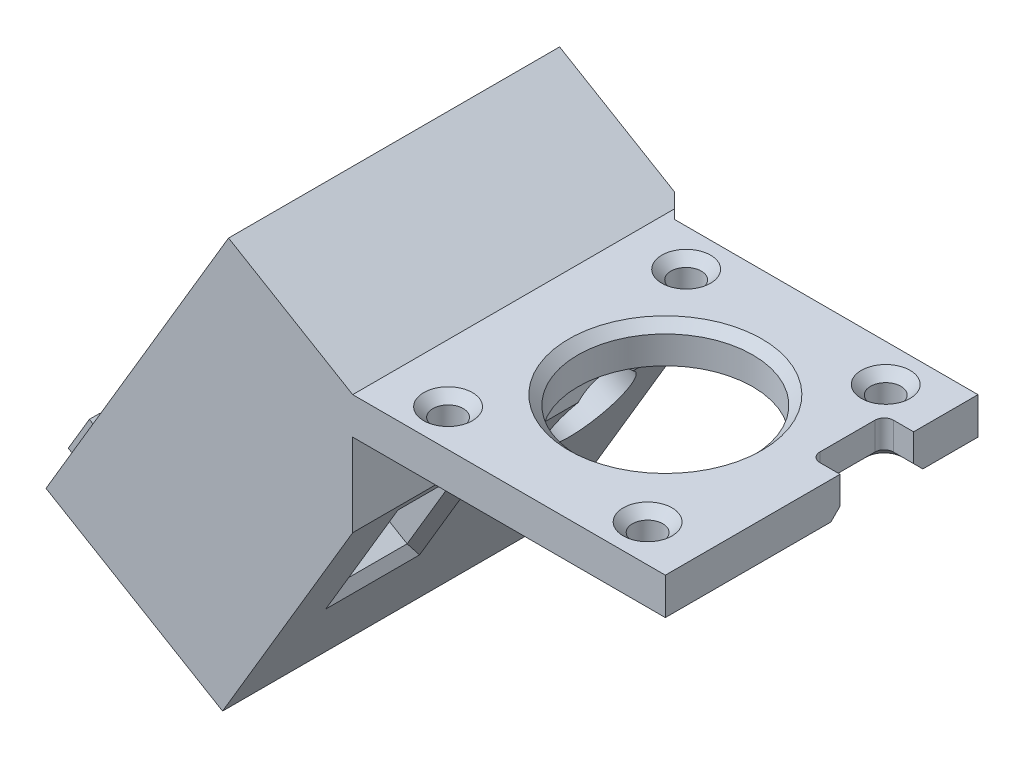
from build123d import *

# Parameters (mm, degrees)
BOSS_EXTRUDE1_DEPTH = 13
BOSS_EXTRUDE2_DEPTH = 2
BOSS_EXTRUDE3_DEPTH = 21
SKETCH4_R           = 4.5
CUT_EXTRUDE1_DEPTH  = 21
SKETCH6_W           = 8.2
SKETCH6_H           = 13.4
CUT_EXTRUDE2_DEPTH  = 21
SKETCH7_R           = 3
CUT_EXTRUDE3_DEPTH  = 21
CHAMFER1_SIZE       = 1
SKETCH8_W           = 1.64117647
SKETCH8_H           = 4.5
BOSS_EXTRUDE4_DEPTH = 1
SKETCH9_W           = 1.164705882
SKETCH9_H           = 4.5
BOSS_EXTRUDE5_DEPTH = 1
SKETCH11_R          = 9.5
SKETCH11_R_2        = 1.65
CUT_EXTRUDE4_DEPTH  = 11
CHAMFER2_SIZE       = 1
SKETCH12_R          = 1.25
CUT_EXTRUDE5_DEPTH  = 11
CHAMFER3_SIZE       = 1


with BuildPart() as part:
    # Sketch1 → Boss-Extrude1 (new body)
    with BuildSketch(Plane.XY):
        Polygon((-31.151261426, -32.880253656), (-50.352784268, -21.501573453), (-48.943272005, -19.123021508), (-46.792543171, -20.397527484), (-44.141570741, -15.924011509), (-40.01217138, -18.371062982), (-35.882772018, -11.40270156), (-32.269547577, -13.543871599), (-29.88430655, -9.518777366), (-25.030353635, -1.327731822), (-32.772977437, 3.260489691), (-30.122005008, 7.734005666), (-32.272733842, 9.008511642), (-30.5, 12), (-17, 4), (17, 4), (17, 0), (0, 0), (-17, 0), (-17, -9), (-22.352925098, -18.033061103), align=None)
    extrude(amount=BOSS_EXTRUDE1_DEPTH)

    # Sketch2 → Boss-Extrude2 (add)
    with BuildSketch(Plane(origin=(0, 0, 0), x_dir=(-1, 0, 0), z_dir=(0, 0, -1))):
        Polygon((30.5, 12), (50.352784268, -21.501573453), (31.151261426, -32.880253656), (17, -9), (17, 0), (17, 4), align=None)
    extrude(amount=BOSS_EXTRUDE2_DEPTH)

    # Sketch3 → Boss-Extrude3 (add)
    with BuildSketch(Plane.XY.offset(13)):
        Polygon((-30.5, 12), (-17, 4), (17, 4), (17, 0), (-17, 0), (-17, -9), (-31.151261426, -32.880253656), (-50.352784268, -21.501573453), align=None)
    extrude(amount=BOSS_EXTRUDE3_DEPTH)

    # Sketch4 → Cut-Extrude1 (cut)
    with BuildSketch(Plane(origin=(-17.942687972, 10.632703984, 0), x_dir=(0, 0, 1), z_dir=(-0.8602915336341741, 0.5098023903017335, 0))):
        with Locations(Location((6.5, -19.777770558, 0), (0, 0, 270))):
            Circle(SKETCH4_R)
    extrude(amount=-CUT_EXTRUDE1_DEPTH, mode=Mode.SUBTRACT)

    # Sketch6 → Cut-Extrude2 (cut)
    with BuildSketch(Plane(origin=(-23.534582941, 13.946419521, 0), x_dir=(0, 0, 1), z_dir=(-0.8602915336341743, 0.5098023903017327, 0))):
        with Locations((23.5, -25.052770558)):
            Rectangle(SKETCH6_W, SKETCH6_H)
    extrude(amount=-CUT_EXTRUDE2_DEPTH, mode=Mode.SUBTRACT)

    # Sketch7 → Cut-Extrude3 (cut)
    with BuildSketch(Plane(origin=(-23.534582941, 13.946419521, 0), x_dir=(0, 0, -1), z_dir=(0.8602915336341744, -0.5098023903017329, 0))):
        with Locations(Location((-23.5, -25.052770558, 0), (0, 0, 90))):
            Circle(SKETCH7_R)
    extrude(amount=-CUT_EXTRUDE3_DEPTH, mode=Mode.SUBTRACT)

    # Chamfer1
    chamfer1_edges = [part.edges().sort_by_distance(p)[0] for p in [
        (-24.822156096, -22.199888412, 23.5),
        (-21.406480081, -16.435935136, 27.6),
        (-17.990804066, -10.671981861, 23.5),
        (-21.406480081, -16.435935136, 19.4),
        (-37.835952426, -10.187141486, 23.5),
    ]]
    chamfer(chamfer1_edges, length=CHAMFER1_SIZE)

    # Sketch8 → Boss-Extrude4 (add)
    with BuildSketch(Plane(origin=(-27.836040609, 16.495431472, 0), x_dir=(0, 0, 1), z_dir=(-0.8602915336341744, 0.5098023903017328, 0))):
        Polygon((21.762045932, -9.829405805), (20.835575344, -11.861023452), (21.814987108, -14.329405805), (20.120869461, -14.329405805), (19.512045932, -12.400361687), (19.512045932, -14.329405805), (17.870869461, -14.329405805), (17.870869461, -9.829405805), (19.512045932, -9.829405805), (19.512045932, -11.57811904), (20.226751814, -9.829405805), align=None)
        with Locations((22.926751814, -12.079405805)):
            Rectangle(SKETCH8_W, SKETCH8_H)
        Polygon((26.023810638, -9.829405805), (26.023810638, -13.429405805), (26.976751814, -13.429405805), (26.976751814, -14.329405805), (24.382634167, -14.329405805), (24.382634167, -9.829405805), align=None)
        Polygon((29.041457696, -9.829405805), (29.041457696, -13.429405805), (29.994398873, -13.429405805), (29.994398873, -14.329405805), (27.400281226, -14.329405805), (27.400281226, -9.829405805), align=None)
    extrude(amount=BOSS_EXTRUDE4_DEPTH)

    # Sketch9 → Boss-Extrude5 (add)
    with BuildSketch(Plane(origin=(-27.836040609, 16.495431472, 0), x_dir=(0, 0, 1), z_dir=(-0.8602915336341744, 0.5098023903017328, 0))):
        with BuildLine():
            Line((17.209107375, -37.633097393), (16.097342669, -37.633097393))
            Line((16.097342669, -37.633097393), (16.097342669, -37.277398864))
            add(Edge.make_bspline(
                [(16.097342669, -37.277398864), (16.097059549, -37.239604298), (16.096550281, -37.171620557), (16.088792417, -37.080784648), (16.076313599, -37.011930154), (16.056626609, -36.96227158), (16.028137975, -36.928987595), (15.993041136, -36.907496458), (15.95083796, -36.893498002), (15.920171119, -36.892470324), (15.903776493, -36.891920923)],
                knots=[0, 0, 0, 0, 1.836110675, 3.302741208, 4.424827114, 5.228882099, 5.865443011, 6.515953015, 7.206622017, 8, 8, 8, 8], degree=3))
            add(Edge.make_bspline(
                [(15.903776493, -36.891920923), (15.885993476, -36.892995265), (15.851785689, -36.895061893), (15.803556703, -36.912122563), (15.762803701, -36.941416297), (15.728887368, -36.981617506), (15.703108749, -37.03347059), (15.687061844, -37.096873777), (15.674760116, -37.17077203), (15.674142709, -37.224117341), (15.673813258, -37.252582687)],
                knots=[0, 0, 0, 0, 0.882142373, 1.69690771, 2.502869523, 3.348502484, 4.286047481, 5.353202765, 6.587654712, 8, 8, 8, 8], degree=3))
            add(Edge.make_bspline(
                [(15.673813258, -37.252582687), (15.674228789, -37.289303202), (15.67500574, -37.357962322), (15.686209736, -37.453578266), (15.701561989, -37.535677077), (15.721080941, -37.583133629), (15.730063258, -37.604972393)],
                knots=[0, 0, 0, 0, 1.225069666, 2.290605275, 3.213363216, 4, 4, 4, 4], degree=3))
            add(Edge.make_bspline(
                [(15.730063258, -37.604972393), (15.735605989, -37.615058255), (15.747505936, -37.636712063), (15.772280796, -37.668154412), (15.803762232, -37.701514844), (15.84369205, -37.734485243), (15.889743606, -37.769962957), (15.94341845, -37.806012253), (16.004762001, -37.8429332), (16.048203299, -37.867573837), (16.070872081, -37.880431952)],
                knots=[0, 0, 0, 0, 0.621359025, 1.334024637, 2.156579786, 3.097725489, 4.129453258, 5.299675385, 6.590901449, 8, 8, 8, 8], degree=3))
            add(Edge.make_bspline(
                [(16.070872081, -37.880431952), (16.136405389, -37.917059196), (16.261959955, -37.987232941), (16.43928748, -38.093048025), (16.597307839, -38.194301062), (16.735859417, -38.291476603), (16.856311874, -38.382318005), (16.956624947, -38.469832642), (17.040524626, -38.550333381), (17.08397564, -38.607570184), (17.104052228, -38.634016511)],
                knots=[0, 0, 0, 0, 1.399987978, 2.682222047, 3.850399669, 4.898912503, 5.837908684, 6.661707281, 7.381640388, 8, 8, 8, 8], degree=3))
            add(Edge.make_bspline(
                [(17.104052228, -38.634016511), (17.121254024, -38.660666458), (17.15694116, -38.715954891), (17.199216128, -38.80937003), (17.234648215, -38.913978856), (17.264125176, -39.029592934), (17.287178399, -39.157020569), (17.303225291, -39.295719032), (17.313282451, -39.445908246), (17.314407049, -39.549716474), (17.314989728, -39.603501805)],
                knots=[0, 0, 0, 0, 0.755791031, 1.567976878, 2.437427939, 3.388209073, 4.411251956, 5.524044322, 6.717152777, 8, 8, 8, 8], degree=3))
            add(Edge.make_bspline(
                [(17.314989728, -39.603501805), (17.314769694, -39.642664591), (17.314343305, -39.718555141), (17.308316322, -39.82836372), (17.299361125, -39.93018575), (17.287430808, -40.023895088), (17.270688645, -40.109439719), (17.2511594, -40.187162313), (17.228168598, -40.257335068), (17.200705288, -40.320355181), (17.167654743, -40.378022742), (17.128212133, -40.432053256), (17.082720674, -40.484278959), (17.030239932, -40.533936569), (16.971162264, -40.581427756), (16.904929372, -40.62559165), (16.832266549, -40.668081972), (16.726136158, -40.722458796), (16.581287636, -40.778810773), (16.394921221, -40.828011394), (16.195027772, -40.856898988), (16.05717973, -40.860607559), (15.986497081, -40.862509158)],
                knots=[0, 0, 0, 0, 1.107497416, 2.146134036, 3.109178252, 3.99813931, 4.816387854, 5.572963339, 6.263472328, 6.90247397, 7.5137991, 8.139334416, 8.791524392, 9.46999425, 10.180043659, 10.932750816, 11.71920202, 12.559741855, 14.303331118, 16.1022349, 18.001390822, 20, 20, 20, 20], degree=3))
            add(Edge.make_bspline(
                [(15.986497081, -40.862509158), (15.947043729, -40.862216277), (15.869679109, -40.861641962), (15.755998015, -40.851706572), (15.646817642, -40.838277772), (15.541897558, -40.81809904), (15.441184406, -40.792905652), (15.345011609, -40.760942501), (15.252692385, -40.725231516), (15.166371713, -40.681846137), (15.085387812, -40.634935339), (15.0110809, -40.584902228), (14.944211494, -40.53141905), (14.884389839, -40.47529238), (14.831832858, -40.415564801), (14.787362793, -40.352239689), (14.748397842, -40.286968902), (14.718599922, -40.216503509), (14.694035736, -40.141326545), (14.672032469, -40.059710991), (14.655638046, -39.970489065), (14.640271659, -39.874032046), (14.629089806, -39.770214383), (14.620860466, -39.659034433), (14.615871615, -39.540679813), (14.615289533, -39.459297134), (14.614989728, -39.417380481)],
                knots=[0, 0, 0, 0, 1.22569019, 2.403472703, 3.543972426, 4.643126245, 5.721812748, 6.767838212, 7.791044494, 8.795125093, 9.766644267, 10.698344559, 11.576276872, 12.424947852, 13.244791156, 14.04372162, 14.827104947, 15.60238474, 16.415346987, 17.284198737, 18.22702467, 19.232968501, 20.319354312, 21.470843584, 22.697342326, 24, 24, 24, 24], degree=3))
            Line((14.614989728, -39.417380481), (14.614989728, -39.115450334))
            Line((14.614989728, -39.115450334), (15.726754434, -39.115450334))
            Line((15.726754434, -39.115450334), (15.726754434, -39.698630481))
            add(Edge.make_bspline(
                [(15.726754434, -39.698630481), (15.726855583, -39.720143763), (15.727047583, -39.760979971), (15.730013149, -39.819134439), (15.732432451, -39.871412388), (15.738928285, -39.917624844), (15.744500195, -39.958269673), (15.754143302, -39.992322553), (15.763548946, -40.020890948), (15.778764144, -40.050762799), (15.804869102, -40.080211278), (15.845714118, -40.10509705), (15.896315804, -40.118811952), (15.932920108, -40.120451842), (15.95258164, -40.121332687)],
                knots=[0, 0, 0, 0, 1.399964175, 2.657392233, 3.790316277, 4.803157454, 5.694193129, 6.456033573, 7.103114065, 7.648944185, 8.628154654, 9.619298185, 10.721236556, 12, 12, 12, 12], degree=3))
            add(Edge.make_bspline(
                [(15.95258164, -40.121332687), (15.972617244, -40.120460109), (16.010873784, -40.118793985), (16.06358649, -40.099555085), (16.108845882, -40.069983042), (16.14388077, -40.026491774), (16.171593259, -39.972238416), (16.189383598, -39.906337742), (16.201197301, -39.829752533), (16.202517914, -39.775063736), (16.203225022, -39.745781217)],
                knots=[0, 0, 0, 0, 0.935550044, 1.786365327, 2.59701399, 3.441515158, 4.372764623, 5.436873315, 6.627601813, 8, 8, 8, 8], degree=3))
            add(Edge.make_bspline(
                [(16.203225022, -39.745781217), (16.202943829, -39.713235918), (16.202404912, -39.650861748), (16.197371372, -39.561730894), (16.189708061, -39.480967869), (16.177037731, -39.40956306), (16.162893851, -39.346377703), (16.143567808, -39.292930872), (16.122910155, -39.246650684), (16.10386989, -39.221603023), (16.094861052, -39.209751805)],
                knots=[0, 0, 0, 0, 1.405345699, 2.693392728, 3.854590553, 4.905871976, 5.824333091, 6.645380771, 7.359066403, 8, 8, 8, 8], degree=3))
            add(Edge.make_bspline(
                [(16.094861052, -39.209751805), (16.084011982, -39.198260384), (16.059603643, -39.172406876), (16.014590904, -39.134228704), (15.958576935, -39.091385757), (15.892824441, -39.042487525), (15.81531102, -38.989646712), (15.727134854, -38.931886733), (15.627220486, -38.869861438), (15.556931952, -38.826980631), (15.519952964, -38.804420923)],
                knots=[0, 0, 0, 0, 0.537557046, 1.209400947, 2.005333879, 2.938205525, 3.997682112, 5.197642862, 6.525672313, 8, 8, 8, 8], degree=3))
            add(Edge.make_bspline(
                [(15.519952964, -38.804420923), (15.482958479, -38.781885373), (15.411791793, -38.738533495), (15.310525688, -38.675211533), (15.218963006, -38.616209587), (15.137756191, -38.561949045), (15.065810091, -38.512936968), (15.004085631, -38.468451982), (14.951562402, -38.428936799), (14.894616357, -38.381356705), (14.833072744, -38.31794244), (14.767498427, -38.232215048), (14.708926024, -38.133761817), (14.656225846, -38.022903348), (14.612510672, -37.897358507), (14.584359186, -37.755130023), (14.564395307, -37.597816067), (14.562853554, -37.487305932), (14.562048552, -37.429604746)],
                knots=[0, 0, 0, 0, 1.160229675, 2.231946262, 3.19886387, 4.077597015, 4.847836815, 5.530373113, 6.115310034, 6.607974679, 7.516703557, 8.475378429, 9.492441335, 10.579318754, 11.758781032, 13.042133943, 14.455595244, 16, 16, 16, 16], degree=3))
            add(Edge.make_bspline(
                [(14.562048552, -37.429604746), (14.562657388, -37.387413745), (14.563831865, -37.306025069), (14.569055049, -37.18839812), (14.580002716, -37.079672811), (14.594498635, -36.979650471), (14.613584482, -36.888226048), (14.636074029, -36.805221226), (14.664413296, -36.731539004), (14.696169217, -36.665451093), (14.733245918, -36.605691223), (14.775776349, -36.550665128), (14.822140567, -36.497467377), (14.875356922, -36.449421513), (14.932936993, -36.403339386), (14.995490284, -36.360387292), (15.063800735, -36.321649262), (15.162528393, -36.273302891), (15.297846811, -36.223604462), (15.473955683, -36.180605881), (15.665612455, -36.154937632), (15.798640699, -36.152173), (15.867379434, -36.150744452)],
                knots=[0, 0, 0, 0, 1.193273294, 2.301887419, 3.328400059, 4.282301227, 5.158594548, 5.968352012, 6.711261984, 7.387819659, 8.039147108, 8.695727846, 9.353002766, 10.031758738, 10.719812256, 11.437875913, 12.174869463, 12.938603669, 14.544867531, 16.239404325, 18.056814251, 20, 20, 20, 20], degree=3))
            add(Edge.make_bspline(
                [(15.867379434, -36.150744452), (15.905710281, -36.151319424), (15.981050343, -36.152449544), (16.091859045, -36.158414635), (16.197916126, -36.171800656), (16.30009961, -36.186427676), (16.397622899, -36.208628327), (16.491200788, -36.233712299), (16.580157041, -36.264507983), (16.664210044, -36.30009708), (16.742774988, -36.338697906), (16.815653274, -36.378687623), (16.879909455, -36.423504653), (16.939553874, -36.467827808), (16.98962687, -36.517818642), (17.035369813, -36.567804623), (17.072305651, -36.621804377), (17.103381823, -36.679103109), (17.128047388, -36.742987231), (17.150588632, -36.814681886), (17.16808744, -36.89677933), (17.184144924, -36.988290243), (17.19510903, -37.090275885), (17.203311996, -37.202009733), (17.208244574, -37.323678629), (17.208812423, -37.408092873), (17.209107375, -37.451939305)],
                knots=[0, 0, 0, 0, 1.258665126, 2.473932015, 3.640650328, 4.767380648, 5.861263212, 6.922053515, 7.947007588, 8.949117803, 9.916776883, 10.82072156, 11.674447384, 12.487508854, 13.255791159, 13.993321992, 14.70902737, 15.397593972, 16.128875377, 16.95354688, 17.862825142, 18.882327294, 20.003040562, 21.228548882, 22.560453324, 24, 24, 24, 24], degree=3))
            Line((17.209107375, -37.451939305), (17.209107375, -37.633097393))
        make_face()
        with BuildLine():
            Line((22.026754434, -36.256626805), (21.498169875, -40.756626805))
            Line((21.498169875, -40.756626805), (20.098537522, -40.756626805))
            add(Edge.make_bspline(
                [(20.098537522, -40.756626805), (20.084836165, -40.667550922), (20.056917018, -40.486041694), (20.012694768, -40.20934968), (19.967948013, -39.922871678), (19.923004272, -39.626560927), (19.874389494, -39.320679293), (19.825973483, -39.004583324), (19.775487813, -38.678943974), (19.741196111, -38.458647074), (19.723813258, -38.34697607)],
                knots=[0, 0, 0, 0, 0.886961713, 1.807354915, 2.757658128, 3.740557375, 4.75688423, 5.805805417, 6.887737802, 8, 8, 8, 8], degree=3))
            add(Edge.make_bspline(
                [(19.723813258, -38.34697607), (19.720258115, -38.373726387), (19.712706102, -38.430550751), (19.700164173, -38.52010909), (19.686983157, -38.619418467), (19.672284257, -38.727809487), (19.655366498, -38.845733924), (19.638128045, -38.972867483), (19.620115174, -39.109418294), (19.60016433, -39.25526972), (19.578537725, -39.41045427), (19.556226204, -39.575072184), (19.533186519, -39.749114382), (19.508443148, -39.932488811), (19.481688798, -40.125151456), (19.454673254, -40.32734142), (19.425467364, -40.538758431), (19.406117124, -40.682998814), (19.396239728, -40.756626805)],
                knots=[0, 0, 0, 0, 0.532647547, 1.131476581, 1.784968113, 2.510033585, 3.290503762, 4.13641348, 5.042381652, 6.009135616, 7.042073887, 8.135064987, 9.288115389, 10.507344018, 11.78736215, 13.127434944, 14.533689464, 16, 16, 16, 16], degree=3))
            Line((19.396239728, -40.756626805), (18.004879434, -40.756626805))
            Line((18.004879434, -40.756626805), (17.473813258, -36.256626805))
            Line((17.473813258, -36.256626805), (18.585577964, -36.256626805))
            Line((18.585577964, -36.256626805), (18.678225022, -37.814255481))
            Line((18.678225022, -37.814255481), (18.770872081, -39.39752754))
            add(Edge.make_bspline(
                [(18.770872081, -39.39752754), (18.78062584, -39.290526029), (18.800770736, -39.069530769), (18.835343711, -38.728074379), (18.876856076, -38.366298668), (18.925391073, -37.984255561), (18.978096549, -37.581332252), (19.036779068, -37.157743427), (19.102258148, -36.713856171), (19.149001168, -36.411286891), (19.17289414, -36.256626805)],
                knots=[0, 0, 0, 0, 0.814202418, 1.681610599, 2.600672967, 3.573592543, 4.599921192, 5.679974836, 6.814105341, 8, 8, 8, 8], degree=3))
            Line((19.17289414, -36.256626805), (20.311129434, -36.256626805))
            add(Edge.make_bspline(
                [(20.311129434, -36.256626805), (20.311892229, -36.265732751), (20.313651558, -36.286734909), (20.318416597, -36.322457699), (20.322039971, -36.366933119), (20.326890903, -36.419913122), (20.334141555, -36.481558714), (20.340216882, -36.551952981), (20.347612446, -36.631121536), (20.357223195, -36.718700055), (20.365940075, -36.81527242), (20.375660384, -36.920375017), (20.387850389, -37.033863788), (20.398995546, -37.15636034), (20.411566205, -37.287594203), (20.424427741, -37.42745554), (20.439945577, -37.575685935), (20.4493797, -37.677480337), (20.454236052, -37.729880481)],
                knots=[0, 0, 0, 0, 0.296286867, 0.68336267, 1.168269994, 1.743036414, 2.408564079, 3.180854494, 4.034102052, 4.986992654, 6.037763634, 7.178394299, 8.409761707, 9.739013846, 11.16702766, 12.684901283, 14.293504884, 16, 16, 16, 16], degree=3))
            Line((20.454236052, -37.729880481), (20.623813258, -39.503409893))
            add(Edge.make_bspline(
                [(20.623813258, -39.503409893), (20.641355399, -39.223747813), (20.676078734, -38.670178003), (20.743914495, -37.849272999), (20.821276665, -37.04636379), (20.883983718, -36.517920078), (20.914989728, -36.256626805)],
                knots=[0, 0, 0, 0, 1.031321366, 2.041422183, 3.031565335, 4, 4, 4, 4], degree=3))
            Line((20.914989728, -36.256626805), (22.026754434, -36.256626805))
        make_face()
        with Locations((22.873813258, -38.506626805)):
            Rectangle(SKETCH9_W, SKETCH9_H)
        Polygon((26.262048552, -36.256626805), (26.262048552, -37.156626805), (25.573813258, -37.156626805), (25.573813258, -40.756626805), (24.409107375, -40.756626805), (24.409107375, -37.156626805), (23.720872081, -37.156626805), (23.720872081, -36.256626805), align=None)
        with BuildLine():
            Line((29.279695611, -38.162509158), (28.114989728, -38.162509158))
            Line((28.114989728, -38.162509158), (28.114989728, -37.393207687))
            add(Edge.make_bspline(
                [(28.114989728, -37.393207687), (28.114788178, -37.366736128), (28.114403934, -37.316269681), (28.112701969, -37.244295463), (28.110492802, -37.180016529), (28.106723271, -37.12367505), (28.100348189, -37.075529094), (28.095342718, -37.035032814), (28.088069528, -37.002251997), (28.076563113, -36.969790449), (28.055640967, -36.936970942), (28.017717021, -36.909487004), (27.968599138, -36.893973642), (27.932571397, -36.892639864), (27.913151493, -36.891920923)],
                knots=[0, 0, 0, 0, 1.544726687, 2.944929139, 4.200879413, 5.297955196, 6.23794902, 7.034364875, 7.678368203, 8.192494392, 9.040394705, 9.90282632, 10.869568031, 12, 12, 12, 12], degree=3))
            add(Edge.make_bspline(
                [(27.913151493, -36.891920923), (27.8911549, -36.892892857), (27.85048248, -36.894689994), (27.795789581, -36.91523181), (27.752600113, -36.948612084), (27.731661029, -36.989834922), (27.720194951, -37.029155244), (27.712043196, -37.067033168), (27.705709481, -37.112370888), (27.700914595, -37.165392884), (27.696981911, -37.225803565), (27.693443289, -37.293906335), (27.692132422, -37.369489979), (27.691691984, -37.422435751), (27.691460317, -37.450284893)],
                knots=[0, 0, 0, 0, 1.155598725, 2.136739789, 3.036817958, 3.968349341, 4.516183911, 5.201276685, 6.010136878, 6.931149896, 8.010557147, 9.205355065, 10.530034411, 12, 12, 12, 12], degree=3))
            Line((27.691460317, -37.450284893), (27.691460317, -39.582821658))
            add(Edge.make_bspline(
                [(27.691460317, -39.582821658), (27.691686635, -39.609568147), (27.692115983, -39.660308819), (27.69349799, -39.733132262), (27.696874791, -39.798488553), (27.701068583, -39.856947797), (27.70552933, -39.907803197), (27.71221048, -39.951721199), (27.720180003, -39.988229395), (27.731576306, -40.026591956), (27.752940196, -40.065544298), (27.793023183, -40.099016298), (27.845411642, -40.118228953), (27.884027671, -40.120244395), (27.904879434, -40.121332687)],
                knots=[0, 0, 0, 0, 1.468217902, 2.785351057, 3.997700678, 5.059882393, 6.002665009, 6.798968732, 7.496679091, 8.051967021, 8.994385089, 9.885836862, 10.858400762, 12, 12, 12, 12], degree=3))
            add(Edge.make_bspline(
                [(27.904879434, -40.121332687), (27.924966432, -40.120393751), (27.96256601, -40.118636214), (28.013114713, -40.09695078), (28.052160474, -40.061665626), (28.073504366, -40.020797748), (28.084629907, -39.979652333), (28.092689313, -39.938992941), (28.100122076, -39.889335932), (28.10566575, -39.830793632), (28.109496477, -39.763182524), (28.113006545, -39.686806488), (28.114321122, -39.601024074), (28.114758839, -39.540909757), (28.114989728, -39.509200334)],
                knots=[0, 0, 0, 0, 0.994869641, 1.862233423, 2.678863542, 3.569930445, 4.113213846, 4.800007244, 5.633212832, 6.612991899, 7.727492041, 9.005853147, 10.420631309, 12, 12, 12, 12], degree=3))
            Line((28.114989728, -39.509200334), (28.114989728, -38.903685628))
            Line((28.114989728, -38.903685628), (29.279695611, -38.903685628))
            Line((29.279695611, -38.903685628), (29.279695611, -39.084843717))
            add(Edge.make_bspline(
                [(29.279695611, -39.084843717), (29.279293769, -39.142748794), (29.278520595, -39.25416247), (29.275011285, -39.414722104), (29.266441879, -39.561982964), (29.255697913, -39.696291829), (29.243372539, -39.817887732), (29.225632366, -39.9262335), (29.206474059, -40.021723687), (29.182914637, -40.105862725), (29.154502132, -40.182296936), (29.118232998, -40.254083882), (29.074958971, -40.323751286), (29.024714467, -40.391615417), (28.965947235, -40.456615661), (28.899842955, -40.519040472), (28.826726686, -40.579699232), (28.747067107, -40.637218084), (28.66115222, -40.690411285), (28.569480823, -40.736462709), (28.472997054, -40.775665951), (28.371341626, -40.807029075), (28.264858771, -40.831571728), (28.15356092, -40.849932451), (28.037453875, -40.860863657), (27.9583957, -40.861953746), (27.918114728, -40.862509158)],
                knots=[0, 0, 0, 0, 1.60388524, 3.085994514, 4.447560134, 5.688764135, 6.81806339, 7.83131035, 8.728510998, 9.514252572, 10.249013364, 10.983337425, 11.737837366, 12.51836543, 13.318779222, 14.161505663, 15.03472216, 15.948286087, 16.880900769, 17.830405001, 18.786276473, 19.762166314, 20.773656038, 21.810742009, 22.88455005, 24, 24, 24, 24], degree=3))
            add(Edge.make_bspline(
                [(27.918114728, -40.862509158), (27.876467788, -40.861747986), (27.795022871, -40.860259436), (27.675391717, -40.852301074), (27.561325901, -40.837417345), (27.452892794, -40.816524064), (27.349768763, -40.7915106), (27.252652505, -40.758773873), (27.160696585, -40.721018323), (27.074743332, -40.677172198), (26.994948106, -40.628375734), (26.922236928, -40.574609148), (26.85604226, -40.516719567), (26.798589804, -40.453031221), (26.745219805, -40.38697876), (26.700902658, -40.314706474), (26.663632601, -40.238110558), (26.632147169, -40.156292892), (26.608251495, -40.0664131), (26.585412156, -39.968093089), (26.56762119, -39.858892315), (26.553329529, -39.739613672), (26.54032416, -39.609776063), (26.532747789, -39.469568664), (26.527595102, -39.318982377), (26.527040511, -39.215271547), (26.526754434, -39.161773864)],
                knots=[0, 0, 0, 0, 1.164709882, 2.277711161, 3.350788139, 4.379106601, 5.364647481, 6.315587438, 7.242048065, 8.142077566, 9.010916049, 9.854478855, 10.668340489, 11.465036737, 12.250194495, 13.039731894, 13.829419881, 14.629912956, 15.486762133, 16.427645602, 17.451879913, 18.578499397, 19.78690161, 21.099970427, 22.504063026, 24, 24, 24, 24], degree=3))
            Line((26.526754434, -39.161773864), (26.526754434, -37.84072607))
            add(Edge.make_bspline(
                [(26.526754434, -37.84072607), (26.526966373, -37.801295431), (26.527376928, -37.72491259), (26.529015161, -37.614061358), (26.531534123, -37.510934951), (26.534484848, -37.415492648), (26.539677635, -37.327820071), (26.545312792, -37.247559574), (26.551946717, -37.175026759), (26.561286771, -37.088140115), (26.581835537, -36.98500457), (26.624451478, -36.865623587), (26.681652373, -36.748001879), (26.756343083, -36.634598679), (26.845600906, -36.526369851), (26.953662345, -36.431200653), (27.076818157, -36.347659077), (27.214920216, -36.277052909), (27.366273769, -36.219873321), (27.529805021, -36.179565324), (27.703974009, -36.15544662), (27.823734957, -36.152336273), (27.885026493, -36.150744452)],
                knots=[0, 0, 0, 0, 0.937542307, 1.816154821, 2.635900757, 3.390305849, 4.086362694, 4.723956183, 5.303270312, 5.818037384, 6.801645988, 7.794821725, 8.823980059, 9.904122776, 11.016359314, 12.149366721, 13.314966876, 14.546480666, 15.828692965, 17.153231992, 18.543074481, 20, 20, 20, 20], degree=3))
            add(Edge.make_bspline(
                [(27.885026493, -36.150744452), (27.926956241, -36.15140425), (28.008985812, -36.152695051), (28.129362038, -36.162079645), (28.244346307, -36.17653636), (28.353869601, -36.197864783), (28.457228193, -36.226431641), (28.555473738, -36.25899404), (28.647831132, -36.299006422), (28.734100201, -36.345190501), (28.813989409, -36.395594363), (28.887791003, -36.44855251), (28.953273598, -36.505678611), (29.013233538, -36.564460093), (29.064274503, -36.627521188), (29.108540069, -36.693423243), (29.146177889, -36.762175198), (29.176074333, -36.835665494), (29.201254523, -36.915372776), (29.222667046, -37.003790147), (29.239297988, -37.10258502), (29.254471735, -37.211220412), (29.265703503, -37.330185151), (29.273846364, -37.459289809), (29.278826628, -37.598315631), (29.279399421, -37.694306387), (29.279695611, -37.743942981)],
                knots=[0, 0, 0, 0, 1.221125361, 2.388957573, 3.514579002, 4.595031365, 5.635371264, 6.6359889, 7.607201422, 8.562883183, 9.483118081, 10.356978739, 11.205412399, 12.011792278, 12.79947963, 13.563474823, 14.321707769, 15.07785385, 15.870276022, 16.754591466, 17.72504, 18.786977982, 19.948885868, 21.204283757, 22.55434172, 24, 24, 24, 24], degree=3))
            Line((29.279695611, -37.743942981), (29.279695611, -38.162509158))
        make_face()
        Polygon((32.456166199, -36.256626805), (32.456166199, -40.756626805), (31.291460317, -40.756626805), (31.291460317, -38.850744452), (30.867930905, -38.850744452), (30.867930905, -40.756626805), (29.703225022, -40.756626805), (29.703225022, -36.256626805), (30.867930905, -36.256626805), (30.867930905, -37.844862099), (31.291460317, -37.844862099), (31.291460317, -36.256626805), align=None)
    extrude(amount=BOSS_EXTRUDE5_DEPTH)

    # Sketch11 → Cut-Extrude4 (cut)
    with BuildSketch(Plane(origin=(0, 4, 0), x_dir=(1, 0, 0), z_dir=(0, 1, 0))):
        with Locations(Location((0, -17, 0), (0, 0, 180))):
            Circle(SKETCH11_R)
        with Locations(Location((-10.681438474, -4.054294075, 0), (0, 0, 180))):
            Circle(SKETCH11_R_2)
        with Locations(Location((11.018561526, -4.054294075, 0), (0, 0, 180))):
            Circle(SKETCH11_R_2)
        with Locations(Location((-10.681438474, -29.945705925, 0), (0, 0, 270))):
            Circle(SKETCH11_R_2)
        with Locations(Location((11.018561526, -29.945705925, 0), (0, 0, 270))):
            Circle(SKETCH11_R_2)
        with BuildLine():
            Line((17, -7), (14.8, -7))
            ThreePointArc((14.8, -7), (14.092893219, -7.292893219), (13.8, -8))
            Line((13.8, -8), (13.8, -14))
            ThreePointArc((13.8, -14), (14.092893219, -14.707106781), (14.8, -15))
            Line((14.8, -15), (17, -15))
            Line((17, -15), (17, -7))
        make_face()
    extrude(amount=-CUT_EXTRUDE4_DEPTH, mode=Mode.SUBTRACT)

    # Chamfer2
    chamfer2_edges = [part.edges().sort_by_distance(p)[0] for p in [
        (-10.681438474, 4, 28.295705925),
        (12.668561526, 4, 4.054294075),
        (-9.031438474, 4, 4.054294075),
        (14.092893219, 0, 14.707106781),
        (13.8, 0, 11),
        (14.092893219, 0, 7.292893219),
        (15.9, 0, 7),
        (15.9, 0, 15),
        (11.018561526, 4, 28.295705925),
        (9.5, 4, 17),
    ]]
    chamfer(chamfer2_edges, length=CHAMFER2_SIZE)

    # Sketch12 → Cut-Extrude5 (cut)
    with BuildSketch(Plane(origin=(-25.685311775, 15.220925496, 0), x_dir=(0, 0, 1), z_dir=(-0.8602915336341674, 0.5098023903017446, 0))):
        with Locations(Location((6.5, -11.202770558, 0), (0, 0, 270))):
            Circle(SKETCH12_R)
        with Locations(Location((6.5, -38.902770558, 0), (0, 0, 90))):
            Circle(SKETCH12_R)
    extrude(amount=-CUT_EXTRUDE5_DEPTH, mode=Mode.SUBTRACT)

    # Chamfer3
    # the kernel refuses this chamfer: 1 mm, written as the material it adds along each edge
    with BuildSketch(Plane(origin=(-17, 4, 0), x_dir=(0.9996219169112968, 0, 0.02749587661058639), z_dir=(0, -1, 0))) as chamfer3_piece_1:
        Polygon((CHAMFER3_SIZE * 0.999621916911, -CHAMFER3_SIZE * 0.0274958766106), (-CHAMFER3_SIZE * 0.0274958766106, -CHAMFER3_SIZE * 0.999621916911), (0, 0), align=None)
    extrude(amount=4)
    # the kernel refuses this chamfer: 1 mm, written as the material it takes off along each edge
    with BuildSketch(Plane(origin=(-17, -11.571682988, -2), x_dir=(0.027495876610585623, 0, 0.9996219169112968), z_dir=(0, 1, 0))) as chamfer3_2_piece_1:
        Polygon((CHAMFER3_SIZE * 0.999621916911, -CHAMFER3_SIZE * 0.0274958766106), (-CHAMFER3_SIZE * 0.0274958766106, -CHAMFER3_SIZE * 0.999621916911), (0, 0), align=None)
    extrude(amount=18.143365976, mode=Mode.SUBTRACT)


solid = part.part
